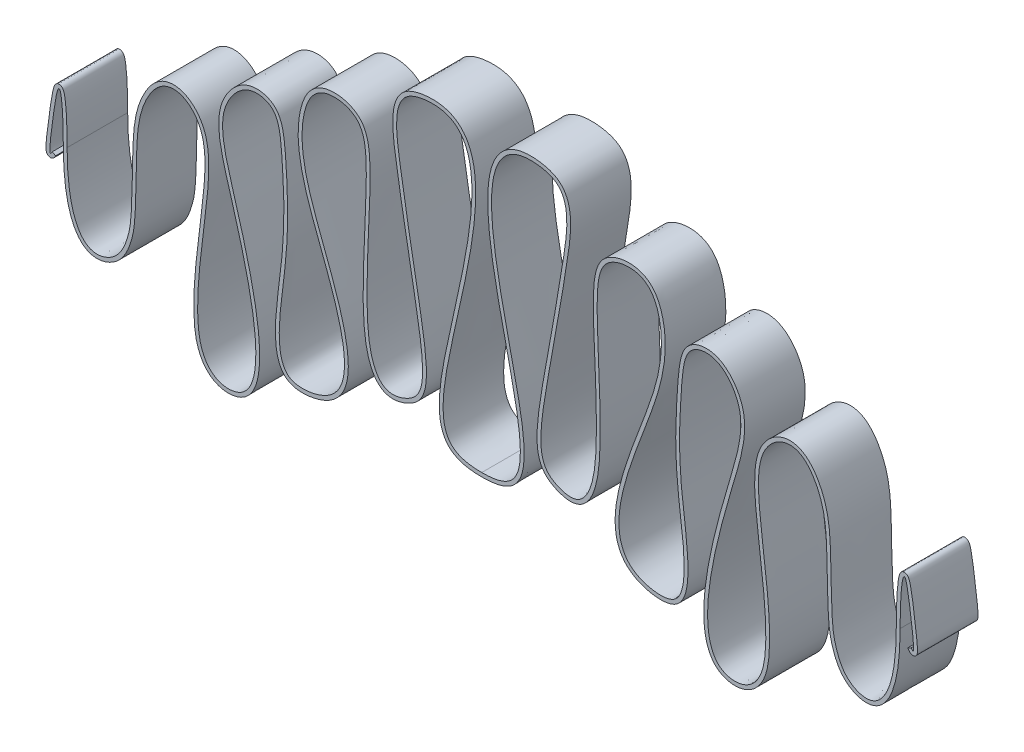
from build123d import *

# Parameters (mm, degrees)
EXTRUDE_THIN4_START = -6.35
EXTRUDE_THIN4_DEPTH = 12.7


# Read off the part's stored shape, not the designer's step: Extrude-Thin4
with BuildPart() as part:
    # Extrude-Thin4 outline → Extrude-Thin4 (new body)
    with BuildSketch(Plane.XY.offset(EXTRUDE_THIN4_START)):
        with BuildLine():
            add(Edge.make_bspline(
                [(-90.049211256, 14.011300175), (-90.877821592, 12.431466891), (-89.629387331, 22.764595701), (-88.457914373, 29.127923939), (-87.725969108, 23.013913117), (-87.725969108, -1.385933452), (-76.810473582, -1.977074826), (-72.601702638, 7.438359684), (-72.599337388, 11.602089364), (-72.178048103, 30.464950452), (-66.510221929, 40.41460738), (-56.110831292, 35.362237981), (-59.065212168, 18.303712378), (-61.87907593, -10.330462304), (-41.10304584, -14.760919695), (-49.548324274, 18.146069154), (-55.932370744, 38.216153657), (-50.09954857, 46.545267987), (-42.531588812, 46.030905187), (-41.966905257, 39.331125567), (-40.865822502, 19.383994989), (-45.957290743, -4.617737295), (-19.663144803, -2.051427695), (-37.796903718, 31.761524472), (-38.010530171, 48.112425815), (-34.236258155, 54.341818563), (-24.564198335, 52.941907298), (-23.717350522, 43.681478371), (-26.404131754, 3.685879826), (-6.522112495, 5.24011673), (-13.024640439, 18.932214292), (-19.03723769, 61.191628495), (7.81282152, 66.642698373), (-14.172065936, 9.457544389), (-7.2536909, 0), (0, 0)],
                knots=[0, 0, 0, 0, 0.132958813, 0.457181009, 1, 1, 2.4398509, 3.50409069, 5.167869976, 5.606916822, 5.944194291, 6.674852372, 7.568589928, 8.169751356, 8.9708431, 11.2177484, 12.097289158, 12.620799027, 13.26429283, 14.343492387, 15.01276034, 15.792889253, 16.127461742, 17.881090416, 18.86062733, 19.929250875, 20.779580044, 21.868782342, 22.836331657, 24.362386291, 28.474473717, 29.15526355, 29.380759406, 32.223504452, 33.717703963, 33.717703963, 33.717703963, 33.717703963], degree=3))
            Line((0, 0), (0, 0.8))
            add(Edge.make_bspline(
                [(0, 0.8), (-1.199878172, 0.8), (-2.245277207, 0.892982862), (-4.033682673, 1.266138881), (-4.77474524, 1.54495704), (-5.995344615, 2.280045196), (-6.479030384, 2.73400953), (-7.265025115, 3.87996446), (-7.566913186, 4.577325578), (-7.982503809, 6.282622427), (-8.094012087, 7.288773022), (-8.117023305, 9.622201294), (-8.028519767, 10.949096741), (-7.479365295, 15.422316157), (-6.7448727, 19.037670091), (-5.041441321, 26.830872005), (-4.073096541, 31.011194163), (-2.410536449, 39.285583078), (-1.715668432, 43.378883633), (-1.263877732, 48.986595911), (-1.21164118, 50.767431523), (-1.374348819, 54.081725225), (-1.588559423, 55.615657101), (-2.37268602, 58.369118826), (-2.944403692, 59.592306838), (-4.154297381, 61.104383238), (-4.616300621, 61.55339438), (-5.659676036, 62.317374554), (-6.240662794, 62.631904098), (-7.513645908, 63.110410675), (-8.205218676, 63.274630737), (-9.696003946, 63.448814501), (-10.494513413, 63.459286475), (-12.209519501, 63.32319487), (-13.127714753, 63.17589046), (-14.438307198, 62.773218927), (-14.864259872, 62.608475073), (-15.466719336, 62.301875166), (-15.662050798, 62.189195113), (-16.033449601, 61.943128769), (-16.20900215, 61.810462043), (-16.704621572, 61.386194708), (-16.993333416, 61.068322761), (-17.489973568, 60.379937342), (-17.698049484, 60.009647013), (-18.21683804, 58.84209013), (-18.423399811, 57.989497882), (-18.650854315, 56.195349193), (-18.671562193, 55.252189868), (-18.597382019, 53.31714929), (-18.502099825, 52.32516387), (-18.255704385, 50.340827519), (-18.104477172, 49.348506965), (-17.80378752, 47.417377891), (-17.654075986, 46.473789214), (-17.207606054, 43.704827694), (-16.913634121, 41.942434582), (-16.051107646, 36.894537367), (-15.501936205, 33.848270403), (-13.999103725, 25.575994067), (-13.190602445, 21.214091288), (-12.534616765, 16.064198842), (-12.409008542, 14.580230165), (-12.380331001, 12.032798016), (-12.478115605, 10.970979), (-12.79896084, 9.657300494), (-12.934432502, 9.265693298), (-13.262851367, 8.559935349), (-13.455540519, 8.245517267), (-13.906986303, 7.67251444), (-14.166051682, 7.413511292), (-14.768459922, 6.935615738), (-15.112147547, 6.716890175), (-15.702091726, 6.415529946), (-15.911080017, 6.319588837), (-16.354820931, 6.136466993), (-16.588721976, 6.049151534), (-17.304244321, 5.818818608), (-17.803671675, 5.707013801), (-18.787533881, 5.637549586), (-19.269692117, 5.678493867), (-20.197312877, 5.969352234), (-20.647284341, 6.216858888), (-21.532906506, 7.045967004), (-21.968221715, 7.632506528), (-22.759174146, 9.283572592), (-23.112652311, 10.346792748), (-23.525776018, 12.366887784), (-23.644101347, 13.110963003), (-23.834385028, 14.751111903), (-23.905758965, 15.651318144), (-24.058237898, 18.540801759), (-24.077873115, 20.714097651), (-23.990169011, 27.516687861), (-23.736720424, 32.427790029), (-23.522323073, 37.575928844), (-23.484713238, 38.555039701), (-23.427824339, 40.385022213), (-23.408189953, 41.239166024), (-23.381693018, 43.634777412), (-23.406948388, 45.009166774), (-23.579195297, 47.401701382), (-23.725553114, 48.420571079), (-24.192365517, 50.193628206), (-24.515663745, 50.950931136), (-25.177084416, 51.914578475), (-25.426455879, 52.205944256), (-25.979127858, 52.728700237), (-26.282470775, 52.960110837), (-27.248062205, 53.567491563), (-27.965701025, 53.858527963), (-29.452593864, 54.238525696), (-30.222497732, 54.327445008), (-31.731340067, 54.30885865), (-32.471239394, 54.201516893), (-33.836074822, 53.77428609), (-34.456166866, 53.454150178), (-35.549871785, 52.622976163), (-36.022656867, 52.113565835), (-36.826742662, 50.944150115), (-37.159128927, 50.284388979), (-37.708381614, 48.833147193), (-37.925505608, 48.041197311), (-38.264729609, 46.332045005), (-38.390926414, 45.4109065), (-38.508404181, 43.38433243), (-38.498853195, 42.280908671), (-38.191138288, 38.637489389), (-37.613577554, 35.763388595), (-35.903752454, 30.509595053), (-35.201162473, 28.613615642), (-33.707507048, 24.658562931), (-32.916414914, 22.59986936), (-31.423094266, 18.458686066), (-30.720962376, 16.376145735), (-29.582603831, 12.333814406), (-29.14689795, 10.373785979), (-28.710821845, 6.735586794), (-28.712263909, 5.059212809), (-29.137575444, 2.878832864), (-29.348997674, 2.207681863), (-29.923402711, 0.984156566), (-30.285767812, 0.431358374), (-31.187778478, -0.560590704), (-31.728069897, -1.000613846), (-32.704971942, -1.570827561), (-33.058393292, -1.745732398), (-33.82567096, -2.062320275), (-34.242202453, -2.204819884), (-35.552043067, -2.565577764), (-36.501655545, -2.71440083), (-37.844298632, -2.731202108), (-38.278079859, -2.702625923), (-39.084683242, -2.571867685), (-39.45710827, -2.469635778), (-40.112516789, -2.19425279), (-40.390478209, -2.023966713), (-40.888315014, -1.59639407), (-41.108687381, -1.339391403), (-41.501192234, -0.729494647), (-41.672599641, -0.37653184), (-41.963788183, 0.420636593), (-42.083397012, 0.864523224), (-42.36569584, 2.31284395), (-42.450959347, 3.433152396), (-42.463175791, 5.872096295), (-42.391013122, 7.190770822), (-42.037600407, 11.294794658), (-41.619629375, 14.226341571), (-41.216284612, 17.68382422), (-41.141857659, 18.365436766), (-41.012674371, 19.696143028), (-40.957157816, 20.345865513), (-40.81503771, 22.249145069), (-40.752865969, 23.45681853), (-40.641634752, 26.904193131), (-40.667894221, 28.968365558), (-40.767491311, 31.743482627), (-40.810714466, 32.614974676), (-40.902077407, 34.255383907), (-40.94903018, 35.022934567), (-41.084389186, 37.191979599), (-41.173420332, 38.458185788), (-41.412491294, 40.688176191), (-41.561701892, 41.65223142), (-41.890667361, 42.920995679), (-42.018120808, 43.3145053), (-42.322378552, 44.047952006), (-42.499449594, 44.388056212), (-42.916005671, 45.011993947), (-43.15579623, 45.295459896), (-43.699563125, 45.79599673), (-44.003042825, 46.012586321), (-44.996531831, 46.561062883), (-45.780095278, 46.802809923), (-47.483655725, 46.936561148), (-48.404157314, 46.825671595), (-49.777905143, 46.302584693), (-50.234207106, 46.068962086), (-51.123523327, 45.472518541), (-51.552513455, 45.111851894), (-52.767011209, 43.880088326), (-53.484485809, 42.857357874), (-54.305340736, 41.133526656), (-54.535977332, 40.527177342), (-54.887386439, 39.269571358), (-55.004759546, 38.621981857), (-55.200576176, 36.649333214), (-55.127501761, 35.287935562), (-54.72111624, 32.474124129), (-54.387485905, 31.020488123), (-53.586664633, 28.011634961), (-53.119159729, 26.45637932), (-51.694827796, 21.634742222), (-50.711603635, 18.183303892), (-48.997379719, 11.289177831), (-48.266828656, 7.846748598), (-47.599182688, 3.067506683), (-47.448007595, 1.538635799), (-47.325830841, -1.32382535), (-47.355129144, -2.657446451), (-47.624666898, -5.057649387), (-47.865511794, -6.123336073), (-48.567811221, -7.918384163), (-49.025757254, -8.644867273), (-49.881734663, -9.47807699), (-50.195878423, -9.714237804), (-50.896668501, -10.106313056), (-51.286558222, -10.263329625), (-52.571990097, -10.596141716), (-53.561064117, -10.62309549), (-55.006138987, -10.237466268), (-55.482335917, -10.038738922), (-56.396553021, -9.475860062), (-56.835071631, -9.111730988), (-58.053711174, -7.716018029), (-58.740066717, -6.378712217), (-59.327255612, -3.527657335), (-59.451992636, -2.43427542), (-59.580116622, -0.05588664), (-59.583995458, 1.22931898), (-59.461087327, 5.244811772), (-59.199864919, 8.134376021), (-58.815472727, 11.610889758), (-58.735718965, 12.29949268), (-58.574659833, 13.653525644), (-58.49347627, 14.318280005), (-58.251907471, 16.273965388), (-58.093359002, 17.52711864), (-57.654120228, 21.13680871), (-57.409512189, 23.343182235), (-57.175248041, 27.374216246), (-57.184420985, 29.19943004), (-57.525145189, 31.671822788), (-57.693636834, 32.451860811), (-58.04933778, 33.554390655), (-58.185088996, 33.910582555), (-58.494229186, 34.599105088), (-58.667792809, 34.931066015), (-59.61964931, 36.513663841), (-60.649807866, 37.542124309), (-62.442130601, 38.516237035), (-63.081587785, 38.745174637), (-64.408580885, 38.96214435), (-65.096143769, 38.948955083), (-66.457525756, 38.639271806), (-67.129565168, 38.343002136), (-68.081842182, 37.680770204), (-68.39095216, 37.422500803), (-68.982029405, 36.841823789), (-69.264782909, 36.520215723), (-70.074836894, 35.477684495), (-70.564445758, 34.678933723), (-71.420827603, 32.953345547), (-71.78733642, 32.025774456), (-72.648491734, 29.174255606), (-72.903936075, 27.208148043), (-73.095927944, 24.414502269), (-73.127714478, 23.509070385), (-73.171538335, 21.79372805), (-73.186587434, 20.988646988), (-73.266872574, 17.201617952), (-73.315317087, 14.929744138), (-73.452137205, 11.370566763), (-73.540820173, 10.085311432), (-73.822204895, 7.968835028), (-74.01230849, 7.136820499), (-74.439134444, 5.764217697), (-74.603185077, 5.28327943), (-74.991366127, 4.328236736), (-75.216946587, 3.852327748), (-75.754675655, 2.942151902), (-76.066531963, 2.508056598), (-76.80147491, 1.713154825), (-77.224227065, 1.351978227), (-77.969626844, 0.884242592), (-78.238171682, 0.739856725), (-78.811575612, 0.483967101), (-79.114414715, 0.373968937), (-80.046997702, 0.125717537), (-80.696752287, 0.06986349), (-81.65308177, 0.236695718), (-81.969980352, 0.333686236), (-82.601546714, 0.632091249), (-82.916685699, 0.833684136), (-83.543179443, 1.37388617), (-83.85448181, 1.712895556), (-84.45971019, 2.561066882), (-84.753368801, 3.070254088), (-85.579923678, 4.892025085), (-86.057073842, 6.499158212), (-86.729799801, 10.66437556), (-86.925969108, 13.221570713), (-86.925969108, 17.88042324), (-86.950380286, 19.276703435), (-87.039947518, 21.729696953), (-87.104969874, 22.785938958), (-87.228329175, 24.092429799), (-87.27373458, 24.481628932), (-87.373759958, 25.167768002), (-87.42790994, 25.46399596), (-87.521433716, 25.848997939), (-87.554633401, 25.967533151), (-87.630556145, 26.192242918), (-87.67235809, 26.298127807), (-87.75822806, 26.461030862), (-87.79086497, 26.516200873), (-87.873495788, 26.631304589), (-87.923393221, 26.691703026), (-88.059311917, 26.814498617), (-88.146848039, 26.877812078), (-88.373963144, 26.974598061), (-88.515016323, 27.004279378), (-88.792823206, 26.992893257), (-88.923719413, 26.953311859), (-89.129608876, 26.850394413), (-89.207305269, 26.7892446), (-89.330889853, 26.67156352), (-89.377503398, 26.614260107), (-89.457462287, 26.502298929), (-89.490546668, 26.447356476), (-89.5797617, 26.281898991), (-89.626458103, 26.170214048), (-89.714964155, 25.924761979), (-89.75607378, 25.791131014), (-89.87883105, 25.340839179), (-89.95987119, 24.97433386), (-90.134060935, 24.05867898), (-90.226749491, 23.51020466), (-90.429586262, 22.196040174), (-90.539673978, 21.430490307), (-90.721588421, 20.095223387), (-90.785019411, 19.618992747), (-90.918064068, 18.600334323), (-90.988339696, 18.055648283), (-91.13263844, 16.906172073), (-91.204377371, 16.311154293), (-91.287036346, 15.48472327), (-91.310442806, 15.220229103), (-91.344755124, 14.726457413), (-91.355771876, 14.497615834), (-91.358764689, 14.184613759), (-91.35751739, 14.085270646), (-91.348727276, 13.893709098), (-91.341435728, 13.801811815), (-91.314609167, 13.614511148), (-91.297100953, 13.520047155), (-91.236016283, 13.348440641), (-91.209639794, 13.285635425), (-91.124602441, 13.14277995), (-91.06526855, 13.060773034), (-90.923665407, 12.940204155), (-90.867517063, 12.901014433), (-90.738697308, 12.834659284), (-90.66603801, 12.807864775), (-90.515792934, 12.775031756), (-90.438676555, 12.769088224), (-90.294166662, 12.775569297), (-90.226924969, 12.787660388), (-90.048024144, 12.837797222), (-89.959466928, 12.887298221), (-89.820480498, 12.982232086), (-89.768677316, 13.029146716), (-89.635146271, 13.164657334), (-89.573529485, 13.249865277), (-89.453954688, 13.432624714), (-89.398198624, 13.530173557), (-89.340744945, 13.639715076)],
                knots=[0, 0, 0, 0, 0.0078125, 0.0078125, 0.015625, 0.015625, 0.0234375, 0.0234375, 0.03125, 0.03125, 0.0390625, 0.0390625, 0.046875, 0.046875, 0.0625, 0.0625, 0.078125, 0.078125, 0.09375, 0.09375, 0.1015625, 0.1015625, 0.109375, 0.109375, 0.1171875, 0.1171875, 0.12109375, 0.12109375, 0.125, 0.125, 0.12890625, 0.12890625, 0.1328125, 0.1328125, 0.13671875, 0.13671875, 0.138671875, 0.138671875, 0.139648437, 0.139648437, 0.140625, 0.140625, 0.142578125, 0.142578125, 0.14453125, 0.14453125, 0.1484375, 0.1484375, 0.15234375, 0.15234375, 0.15625, 0.15625, 0.16015625, 0.16015625, 0.1640625, 0.1640625, 0.171875, 0.171875, 0.1875, 0.1875, 0.21875, 0.21875, 0.234375, 0.234375, 0.25, 0.25, 0.2578125, 0.2578125, 0.265625, 0.265625, 0.2734375, 0.2734375, 0.28125, 0.28125, 0.28515625, 0.28515625, 0.2890625, 0.2890625, 0.296875, 0.296875, 0.3046875, 0.3046875, 0.3125, 0.3125, 0.3203125, 0.3203125, 0.328125, 0.328125, 0.33203125, 0.33203125, 0.3359375, 0.3359375, 0.34375, 0.34375, 0.359375, 0.359375, 0.36328125, 0.36328125, 0.3671875, 0.3671875, 0.375, 0.375, 0.3828125, 0.3828125, 0.390625, 0.390625, 0.39453125, 0.39453125, 0.3984375, 0.3984375, 0.40625, 0.40625, 0.4140625, 0.4140625, 0.421875, 0.421875, 0.4296875, 0.4296875, 0.4375, 0.4375, 0.4453125, 0.4453125, 0.453125, 0.453125, 0.4609375, 0.4609375, 0.46875, 0.46875, 0.484375, 0.484375, 0.4921875, 0.4921875, 0.5, 0.5, 0.5078125, 0.5078125, 0.515625, 0.515625, 0.5234375, 0.5234375, 0.52734375, 0.52734375, 0.53125, 0.53125, 0.53515625, 0.53515625, 0.537109375, 0.537109375, 0.5390625, 0.5390625, 0.54296875, 0.54296875, 0.544921875, 0.544921875, 0.546875, 0.546875, 0.548828125, 0.548828125, 0.55078125, 0.55078125, 0.552734375, 0.552734375, 0.5546875, 0.5546875, 0.55859375, 0.55859375, 0.5625, 0.5625, 0.5703125, 0.5703125, 0.572265625, 0.572265625, 0.57421875, 0.57421875, 0.578125, 0.578125, 0.5859375, 0.5859375, 0.58984375, 0.58984375, 0.59375, 0.59375, 0.6015625, 0.6015625, 0.609375, 0.609375, 0.61328125, 0.61328125, 0.6171875, 0.6171875, 0.62109375, 0.62109375, 0.625, 0.625, 0.6328125, 0.6328125, 0.640625, 0.640625, 0.64453125, 0.64453125, 0.6484375, 0.6484375, 0.65625, 0.65625, 0.66015625, 0.66015625, 0.6640625, 0.6640625, 0.671875, 0.671875, 0.6796875, 0.6796875, 0.6875, 0.6875, 0.703125, 0.703125, 0.71875, 0.71875, 0.7265625, 0.7265625, 0.734375, 0.734375, 0.7421875, 0.7421875, 0.75, 0.75, 0.75390625, 0.75390625, 0.7578125, 0.7578125, 0.765625, 0.765625, 0.76953125, 0.76953125, 0.7734375, 0.7734375, 0.78125, 0.78125, 0.78515625, 0.78515625, 0.7890625, 0.7890625, 0.796875, 0.796875, 0.798828125, 0.798828125, 0.80078125, 0.80078125, 0.8046875, 0.8046875, 0.8125, 0.8125, 0.8203125, 0.8203125, 0.82421875, 0.82421875, 0.826171875, 0.826171875, 0.828125, 0.828125, 0.8359375, 0.8359375, 0.83984375, 0.83984375, 0.84375, 0.84375, 0.84765625, 0.84765625, 0.849609375, 0.849609375, 0.8515625, 0.8515625, 0.85546875, 0.85546875, 0.859375, 0.859375, 0.8671875, 0.8671875, 0.87109375, 0.87109375, 0.875, 0.875, 0.890625, 0.890625, 0.90625, 0.90625, 0.921875, 0.921875, 0.9296875, 0.9296875, 0.9375, 0.9375, 0.9453125, 0.9453125, 0.953125, 0.953125, 0.95703125, 0.95703125, 0.9609375, 0.9609375, 0.96875, 0.96875, 0.97265625, 0.97265625, 0.9765625, 0.9765625, 0.98046875, 0.98046875, 0.984375, 0.984375, 0.9921875, 0.9921875, 1, 1, 1.003882881, 1.003882881, 1.007765762, 1.007765762, 1.009707202, 1.009707202, 1.011648642, 1.011648642, 1.012619363, 1.012619363, 1.013590083, 1.013590083, 1.014075443, 1.014075443, 1.014560803, 1.014560803, 1.015046163, 1.015046163, 1.015531523, 1.015531523, 1.016016883, 1.016016883, 1.016502243, 1.016502243, 1.016987604, 1.016987604, 1.017472964, 1.017472964, 1.018443684, 1.018443684, 1.019414404, 1.019414404, 1.021355844, 1.021355844, 1.023297285, 1.023297285, 1.025238725, 1.025238725, 1.026209445, 1.026209445, 1.027180166, 1.027180166, 1.028150886, 1.028150886, 1.028636246, 1.028636246, 1.029121606, 1.029121606, 1.029364286, 1.029364286, 1.029606966, 1.029606966, 1.029849646, 1.029849646, 1.029970986, 1.029970986, 1.030092326, 1.030092326, 1.030152996, 1.030152996, 1.030213666, 1.030213666, 1.030274336, 1.030274336, 1.030335006, 1.030335006, 1.030456346, 1.030456346, 1.030577686, 1.030577686, 1.030820366, 1.030820366, 1.031063046, 1.031063046, 1.031063046, 1.031063046], degree=3))
            Line((-89.340744945, 13.639715076), (-90.049211256, 14.011300175))
        make_face()
    extrude_thin4 = extrude(amount=EXTRUDE_THIN4_DEPTH)

    # Mirror1: Extrude-Thin4 across plane
    add(extrude_thin4.mirror(Plane(origin=(0, 0, 0), x_dir=(0, 0, 1), z_dir=(1, 0, 0))))


solid = part.part
